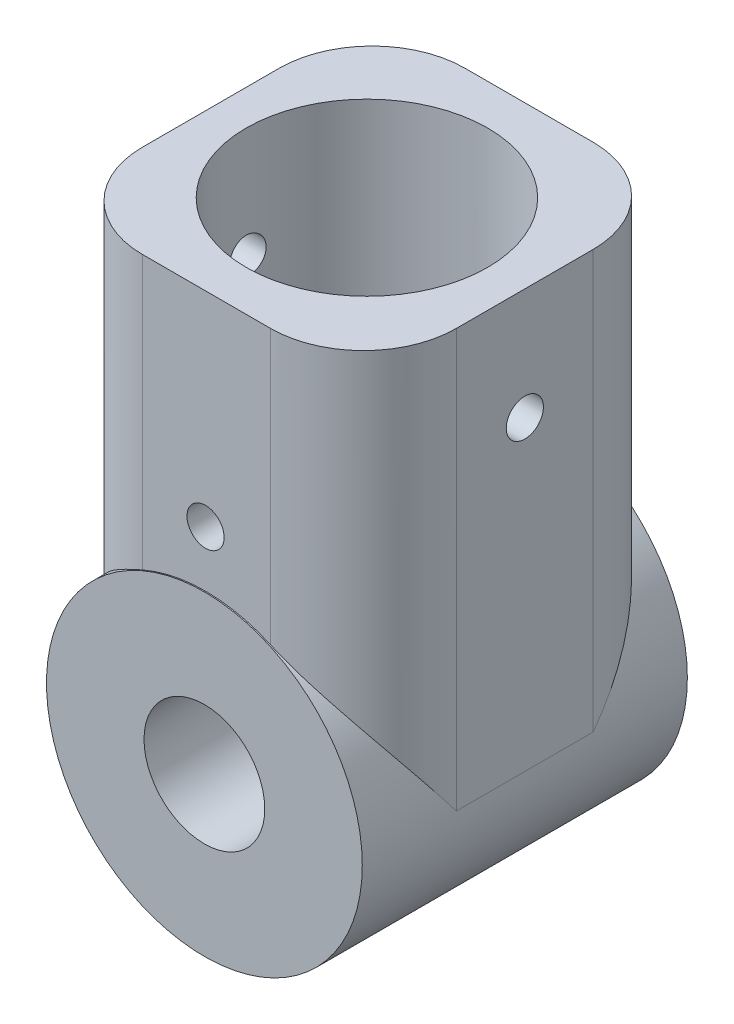
from build123d import *
from build123d.topology import SkipClean

# Parameters (mm, degrees)
SKETCH_1_R           = 17
SKETCH_1_R_2         = 6.5
EXTRUDE_2_DEPTH      = 35
SKETCH_3_W           = 33.795275063
SKETCH_3_H           = 34.72803434
SKETCH_3_R           = 13
EXTRUDE_7_DEPTH      = 45
SKETCH_4_R           = 6.5
CUT_EXTRUDE_1_DEPTH  = 60.489495005
SKETCH_12_R          = 2
CUT_EXTRUDE_11_DEPTH = 45
SKETCH_15_R          = 2
CUT_EXTRUDE_12_DEPTH = 45
FILLET_4_R           = 10
SKETCH_20_R          = 13
CUT_EXTRUDE_18_DEPTH = 31
EXTRUDE_START        = 1
SKETCH_25_R          = 13
EXTRUDE_10_DEPTH     = 1
SKETCH_26_R          = 6.5
SKETCH_26_R_2        = 5.5
EXTRUDE_11_DEPTH     = 2


with BuildPart() as part:
    # Эскиз1 → Бобышка-Вытянуть2 (new body)
    with BuildSketch(Plane.XY):
        Circle(SKETCH_1_R)
        Circle(SKETCH_1_R_2, mode=Mode.SUBTRACT)
    extrude(amount=EXTRUDE_2_DEPTH)

    # Эскиз3 → Бобышка-Вытянуть7 (add)
    with BuildSketch(Plane(origin=(0, 45, 0), x_dir=(1, 0, 0), z_dir=(0, 1, 0))):
        with Locations((0.102362468, -17.511098906)):
            Rectangle(SKETCH_3_W, SKETCH_3_H)
        with Locations(Location((0, -17.5, 0), (0, 0, 270))):
            Circle(SKETCH_3_R, mode=Mode.SUBTRACT)
    extrude(amount=-EXTRUDE_7_DEPTH)

    # Эскиз4 → Вырез-Вытянуть1 (cut, through all)
    with BuildSketch(Plane(origin=(0, 0, 0), x_dir=(-1, 0, 0), z_dir=(0, 0, -1))):
        with Locations(Location((0, 0, 0), (0, 0, 180))):
            Circle(SKETCH_4_R)
    extrude(amount=-CUT_EXTRUDE_1_DEPTH, mode=Mode.SUBTRACT)

    # Эскиз12 → Вырез-Вытянуть11 (cut)
    with BuildSketch(Plane(origin=(0, 0, 0), x_dir=(-1, 0, 0), z_dir=(0, 0, -1))):
        with Locations((0, 23)):
            Circle(SKETCH_12_R)
    extrude(amount=-CUT_EXTRUDE_11_DEPTH, mode=Mode.SUBTRACT)

    # Эскиз15 → Вырез-Вытянуть12 (cut)
    with BuildSketch(Plane.ZY.offset(16.795275063)):
        with Locations((17.5, 33)):
            Circle(SKETCH_15_R)
    extrude(amount=-CUT_EXTRUDE_12_DEPTH, mode=Mode.SUBTRACT)

    # Скругление4
    # the kernel refuses this fillet: 10 mm, written as the material it takes off along each edge
    with BuildSketch(Plane(origin=(-16.795275063, 70, 34.875116076), x_dir=(1, 0, 0), z_dir=(0, -1, 0))) as fillet_4_piece_1_section:
        with BuildLine():
            CenterArc((FILLET_4_R, -FILLET_4_R), FILLET_4_R, 90, 90)
            Line((0, -FILLET_4_R), (0, 0))
            Line((0, 0), (FILLET_4_R, 0))
        make_face()
    fillet_4_piece_1 = extrude(amount=92.369651061, mode=Mode.PRIVATE)
    fillet_4_piece_1 = fillet_4_piece_1 - Plane(origin=(0, 0, 32.54483178), x_dir=(1, 0, 0), z_dir=(0, 0, -1)) * Cylinder(17, 225, mode=Mode.PRIVATE)
    add(fillet_4_piece_1, mode=Mode.SUBTRACT)
    with BuildSketch(Plane(origin=(17, 70, 0.147081736), x_dir=(0, 0, 1), z_dir=(0, -1, 0))) as fillet_4_piece_2_section:
        with BuildLine():
            CenterArc((FILLET_4_R, FILLET_4_R), FILLET_4_R, 180, 90)
            Line((0, FILLET_4_R), (0, 0))
            Line((0, 0), (FILLET_4_R, 0))
        make_face()
    fillet_4_piece_2 = extrude(amount=95, mode=Mode.PRIVATE)
    fillet_4_piece_2 = fillet_4_piece_2 - Plane(origin=(0, 0, 2.486350956), x_dir=(1, 0, 0), z_dir=(0, 0, -1)) * Cylinder(17, 230, mode=Mode.PRIVATE)
    add(fillet_4_piece_2, mode=Mode.SUBTRACT)
    with BuildSketch(Plane(origin=(17, 70, 34.875116076), x_dir=(0, 0, -1), z_dir=(0, -1, 0))) as fillet_4_piece_3_section:
        with BuildLine():
            CenterArc((FILLET_4_R, -FILLET_4_R), FILLET_4_R, 90, 90)
            Line((0, -FILLET_4_R), (0, 0))
            Line((0, 0), (FILLET_4_R, 0))
        make_face()
    fillet_4_piece_3 = extrude(amount=95, mode=Mode.PRIVATE)
    fillet_4_piece_3 = fillet_4_piece_3 - Plane(origin=(0, 0, 32.535846855), x_dir=(1, 0, 0), z_dir=(0, 0, -1)) * Cylinder(17, 230, mode=Mode.PRIVATE)
    add(fillet_4_piece_3, mode=Mode.SUBTRACT)
    with BuildSketch(Plane(origin=(-16.795275063, 70, 0.147081736), x_dir=(0, 0, 1), z_dir=(0, -1, 0))) as fillet_4_piece_4_section:
        with BuildLine():
            CenterArc((FILLET_4_R, -FILLET_4_R), FILLET_4_R, 90, 90)
            Line((0, -FILLET_4_R), (0, 0))
            Line((0, 0), (FILLET_4_R, 0))
        make_face()
    fillet_4_piece_4 = extrude(amount=92.369651061, mode=Mode.PRIVATE)
    fillet_4_piece_4 = fillet_4_piece_4 - Plane(origin=(0, 0, 2.477367304), x_dir=(1, 0, 0), z_dir=(0, 0, -1)) * Cylinder(17, 225, mode=Mode.PRIVATE)
    add(fillet_4_piece_4, mode=Mode.SUBTRACT)

    # Эскиз20 → Вырез-Вытянуть18 (cut)
    with SkipClean():  # the faces are left unmerged after this step: merging them gives an invalid solid
        with BuildSketch(Plane(origin=(0, 45, 0), x_dir=(1, 0, 0), z_dir=(0, 1, 0))):
            with Locations(Location((0, -17.5, 0), (0, 0, 270))):
                Circle(SKETCH_20_R)
        extrude(amount=-CUT_EXTRUDE_18_DEPTH, mode=Mode.SUBTRACT)

    # Эскиз25 → Бобышка-Вытянуть10 (add)
    with BuildSketch(Plane(origin=(0, 14, 0), x_dir=(1, 0, 0), z_dir=(0, 1, 0)).offset(EXTRUDE_START)):
        with Locations(Location((0, -17.5, 0), (0, 0, 270))):
            Circle(SKETCH_25_R)
    extrude(amount=-EXTRUDE_10_DEPTH)

    # Эскиз26 → Бобышка-Вытянуть11 (add)
    with BuildSketch(Plane(origin=(0, 0, 0), x_dir=(-1, 0, 0), z_dir=(0, 0, -1))):
        Circle(SKETCH_26_R)
        Circle(SKETCH_26_R_2, mode=Mode.SUBTRACT)
    extrude(amount=-EXTRUDE_11_DEPTH)


solid = part.part
